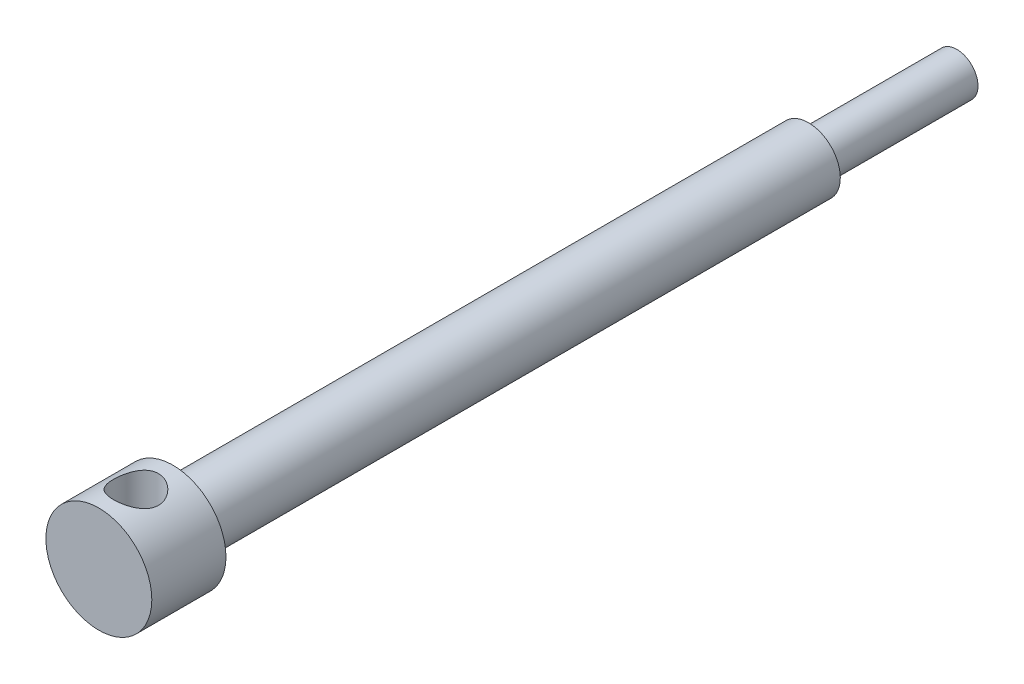
from build123d import *

# Parameters (mm, degrees)
F_97_0_0059_DIAMETER_HOLE1_D           = 6.7564
F_97_0_0059_DIAMETER_HOLE1_ON_FACE_2_D = 6.7564


with BuildPart() as part:
    # Sketch1 → Revolve1 (revolve)
    with BuildSketch(Plane(origin=(0, 0, 0), x_dir=(0, 0, -1), z_dir=(1, 0, 0))):
        Polygon((-5.55625, 0), (-5.55625, 7.9375), (5.55625, 7.9375), (5.55625, 4.7625), (100.80625, 4.7625), (100.80625, 3.175), (123.03125, 3.175), (123.03125, 0), align=None)
    revolve(axis=Axis((0, 0, 83.264258346), (0, 0, -1)))

    # #97 (0.0059) Diameter Hole1 (through all)
    with Locations(Plane(origin=(0, -7.9375, 0), x_dir=(-1, 0, 0), z_dir=(0, -1, 0))):
        with Locations((0, 0)):
            Hole(F_97_0_0059_DIAMETER_HOLE1_D / 2)

    # #97 (0.0059) Diameter Hole1 on face 2 (through all)
    with Locations(Plane(origin=(0, 0, 0), x_dir=(-1, 0, 0), z_dir=(0, -1, 0))):
        with Locations((0, 0)):
            Hole(F_97_0_0059_DIAMETER_HOLE1_ON_FACE_2_D / 2)


solid = part.part
